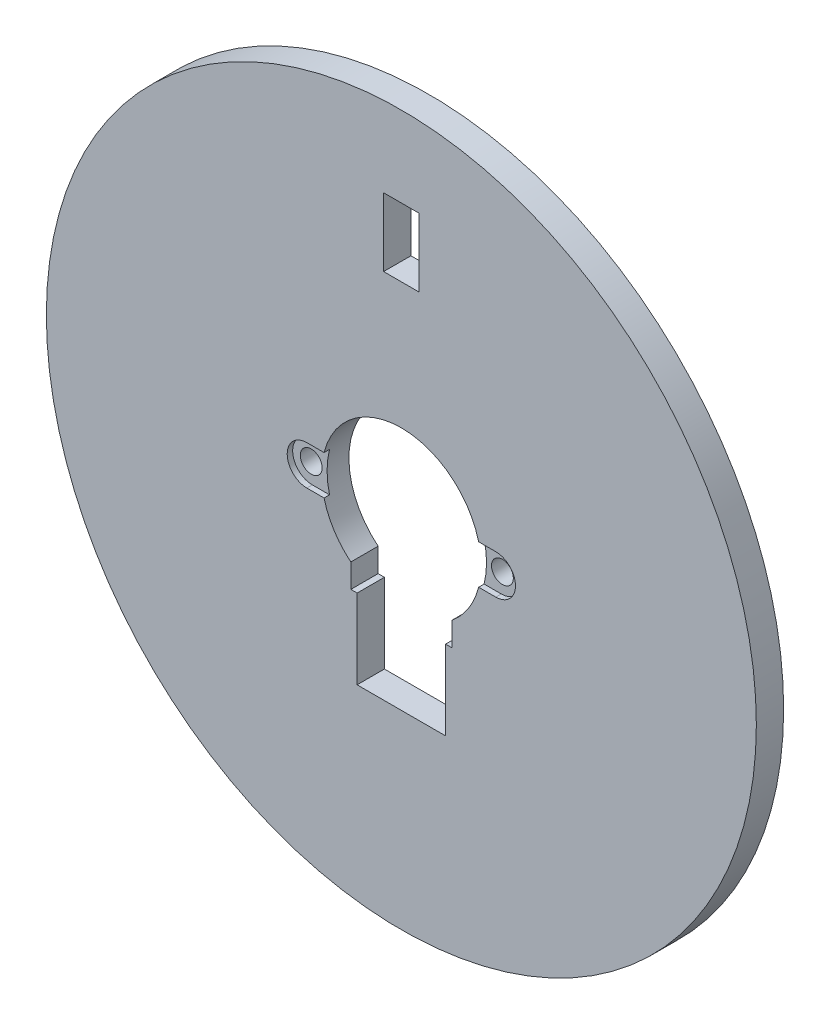
from build123d import *

# Parameters (mm, degrees)
SKETCH1_R           = 65
SKETCH1_R_2         = 2
SKETCH1_W           = 6.5
SKETCH1_H           = 12.5
BOSS_EXTRUDE1_DEPTH = 5
SKETCH1_3_R         = 2
BOSS_EXTRUDE2_DEPTH = 4
SKETCH1_4_R         = 2
BOSS_EXTRUDE3_DEPTH = 1
SKETCH1_6_R         = 2
BOSS_EXTRUDE6_DEPTH = 5
SKETCH1_7_R         = 2
CUT_EXTRUDE1_DEPTH  = 3


with BuildPart() as part:
    # Sketch1 → Boss-Extrude1 (new body)
    with BuildSketch(Plane.XY):
        Circle(SKETCH1_R)
        with BuildLine():
            Line((-17.3, 3.6), (-14.149204925, 3.6))
            ThreePointArc((-14.149204925, 3.6), (0, 14.6), (14.149204925, 3.6))
            Line((14.149204925, 3.6), (17.3, 3.6))
            ThreePointArc((17.3, 3.6), (20.9, 0), (17.3, -3.6))
            Line((17.3, -3.6), (14.149204925, -3.6))
            ThreePointArc((14.149204925, -3.6), (12.316145556, -7.840443778), (9.25, -11.295906338))
            Line((9.25, -11.295906338), (9.25, -15.647016094))
            Line((9.25, -15.647016094), (8.1, -15.647016094))
            Line((8.1, -15.647016094), (8.1, -30.2))
            Line((8.1, -30.2), (-8.1, -30.2))
            Line((-8.1, -30.2), (-8.1, -15.647016094))
            Line((-8.1, -15.647016094), (-9.25, -15.647016094))
            Line((-9.25, -15.647016094), (-9.25, -11.295906338))
            ThreePointArc((-9.25, -11.295906338), (-12.316145556, -7.840443778), (-14.149204925, -3.6))
            Line((-14.149204925, -3.6), (-17.3, -3.6))
            ThreePointArc((-17.3, -3.6), (-20.9, 0), (-17.3, 3.6))
        make_face(mode=Mode.SUBTRACT)
        with Locations((0, 32)):
            Circle(SKETCH1_R_2, mode=Mode.SUBTRACT)
        with Locations((0, 44)):
            Rectangle(SKETCH1_W, SKETCH1_H, mode=Mode.SUBTRACT)
        with Locations((0, 56)):
            Circle(SKETCH1_R_2, mode=Mode.SUBTRACT)
    extrude(amount=BOSS_EXTRUDE1_DEPTH)

    # Sketch1<3> → Boss-Extrude2 (add)
    # profile 1 of 2: a face of its own
    with BuildSketch(Plane.XY):
        with BuildLine():
            ThreePointArc((-14.149204925, -3.6), (-14.6, 0), (-14.149204925, 3.6))
            Line((-14.149204925, 3.6), (-17.3, 3.6))
            ThreePointArc((-17.3, 3.6), (-20.9, 0), (-17.3, -3.6))
            Line((-17.3, -3.6), (-14.149204925, -3.6))
        make_face()
        with Locations((-17.5, 0)):
            Circle(SKETCH1_3_R, mode=Mode.SUBTRACT)
    # profile 2 of 2: a face of its own
    with BuildSketch(Plane.XY):
        with BuildLine():
            Line((17.3, 3.6), (14.149204925, 3.6))
            ThreePointArc((14.149204925, 3.6), (14.6, 0), (14.149204925, -3.6))
            Line((14.149204925, -3.6), (17.3, -3.6))
            ThreePointArc((17.3, -3.6), (20.9, 0), (17.3, 3.6))
        make_face()
        with Locations((17.5, 0)):
            Circle(SKETCH1_3_R, mode=Mode.SUBTRACT)
    extrude(amount=BOSS_EXTRUDE2_DEPTH)

    # Sketch1<4> → Boss-Extrude3 (add)
    with BuildSketch(Plane.XY):
        with Locations((17.5, 0)):
            Circle(SKETCH1_4_R)
        with Locations((-17.5, 0)):
            Circle(SKETCH1_4_R)
    extrude(amount=BOSS_EXTRUDE3_DEPTH)

    # Sketch1<6> → Boss-Extrude6 (add)
    with BuildSketch(Plane.XY):
        with Locations((0, 56)):
            Circle(SKETCH1_6_R)
        with Locations((0, 32)):
            Circle(SKETCH1_6_R)
    extrude(amount=BOSS_EXTRUDE6_DEPTH)

    # Sketch1<7> → Cut-Extrude1 (cut)
    with BuildSketch(Plane.XY):
        with Locations((0, 56)):
            Circle(SKETCH1_7_R)
        with Locations((0, 32)):
            Circle(SKETCH1_7_R)
    extrude(amount=CUT_EXTRUDE1_DEPTH, mode=Mode.SUBTRACT)


solid = part.part
